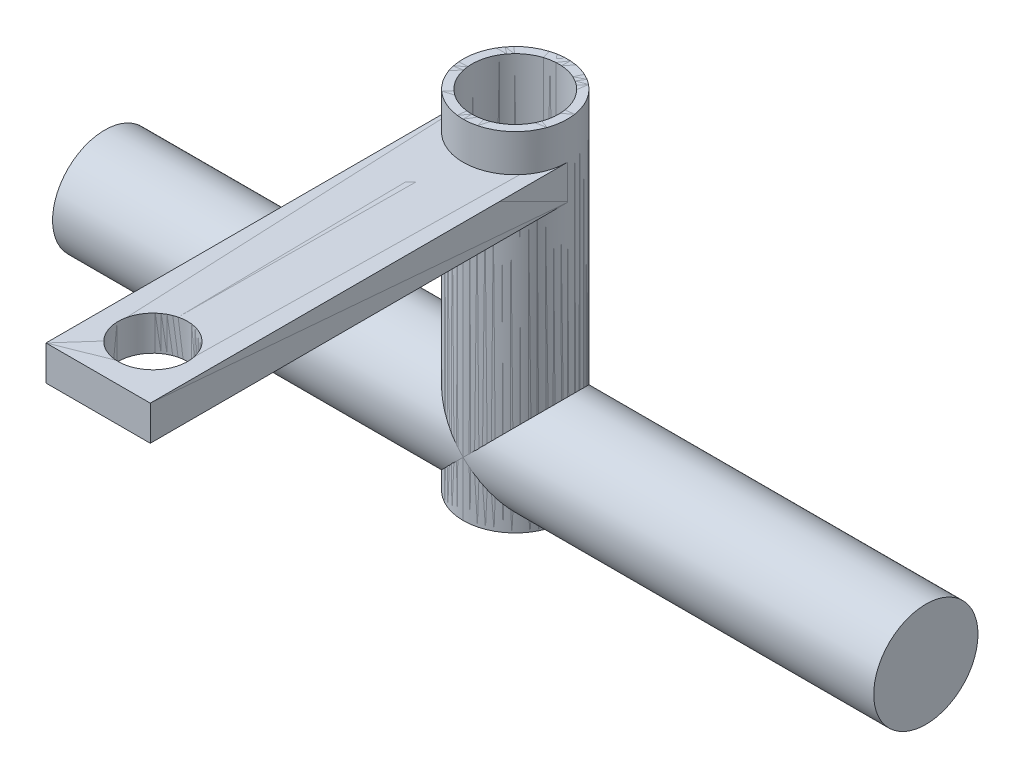
from build123d import *

# Parameters (mm, degrees)
SKETCH1_R          = 9.525
SLEEVE_DEPTH       = 63.5
SKETCH2_W          = 19.05
SKETCH2_H          = 6.35
BRACKET_DEPTH      = 76.2
SKETCH4_R          = 6.35
BRACKET_HOLE_DEPTH = 100.646453148
SKETCH5_R          = 9.525
SHAFT_DEPTH        = 75
SKETCH6_R          = 7.9375
SLEEVE_HOLE_DEPTH  = 125.353086009


with BuildPart() as part:
    # Sketch1 → Sleeve (new body)
    with BuildSketch(Plane(origin=(0, 0, 0), x_dir=(1, 0, 0), z_dir=(0, 1, 0))):
        Circle(SKETCH1_R)
    extrude(amount=SLEEVE_DEPTH)

    # Sketch2 → Bracket (add)
    with BuildSketch(Plane.XY):
        with Locations((0, 53.5)):
            Rectangle(SKETCH2_W, SKETCH2_H)
    extrude(amount=BRACKET_DEPTH)

    # Sketch4 → Bracket Hole (cut, through all)
    with BuildSketch(Plane(origin=(0, 0, 0), x_dir=(1, 0, 0), z_dir=(0, 1, 0))):
        with Locations((0, -66.2)):
            Circle(SKETCH4_R)
    extrude(amount=BRACKET_HOLE_DEPTH, mode=Mode.SUBTRACT)

    # Sketch5 → Shaft (add)
    with BuildSketch(Plane(origin=(0, 0, 0), x_dir=(0, 0, -1), z_dir=(1, 0, 0))):
        with Locations((0, 10)):
            Circle(SKETCH5_R)
    extrude(amount=SHAFT_DEPTH)

    # Sketch6 → Sleeve Hole (cut, through all)
    with BuildSketch(Plane(origin=(0, 0, 0), x_dir=(1, 0, 0), z_dir=(0, 1, 0))):
        Circle(SKETCH6_R)
    extrude(amount=SLEEVE_HOLE_DEPTH, mode=Mode.SUBTRACT)


with BuildPart() as body_2:
    # Mirror1: mirrored copy
    add(part.part.mirror(Plane(origin=(0, 0, 0), x_dir=(0, 0, 1), z_dir=(1, 0, 0))))


solid = Compound([part.part, body_2.part])
